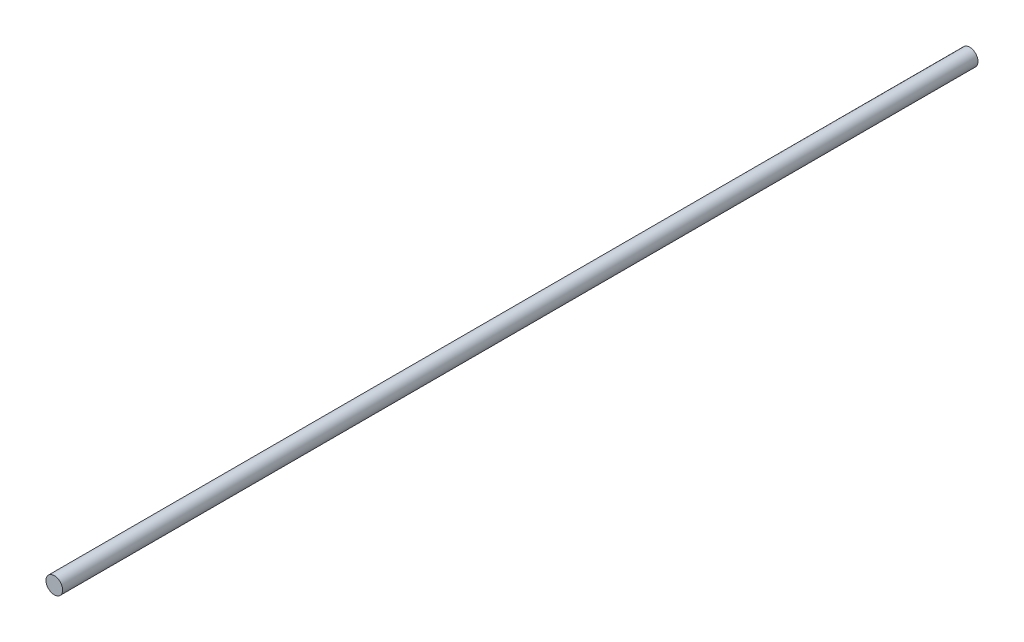
from build123d import *

# Parameters (mm, degrees)
BOSS_EXTRUDE1_DEPTH      = 110
BOSS_EXTRUDE1_DEPTH_BACK = 110
SKETCH1_R                = 2


with BuildPart() as part:
    # Sketch1 → Boss-Extrude1 (new, two sides: drawn at the far end of the back side and taken through both)
    with BuildSketch(Plane.XY.offset(-BOSS_EXTRUDE1_DEPTH_BACK)):
        Circle(SKETCH1_R)
    extrude(amount=BOSS_EXTRUDE1_DEPTH + BOSS_EXTRUDE1_DEPTH_BACK)


solid = part.part
